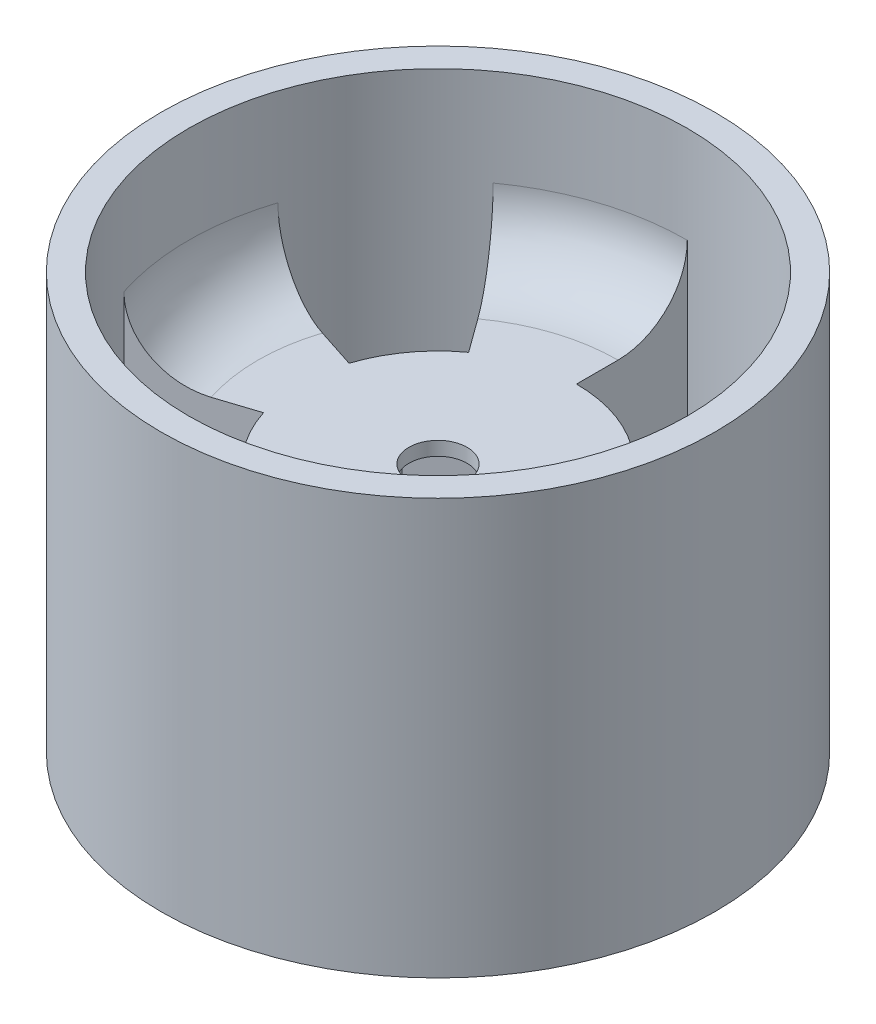
from build123d import *
from build123d.topology import SkipClean

# Parameters (mm, degrees)
SKETCH1_R           = 18
BOSS_EXTRUDE1_DEPTH = 6
CUT_EXTRUDE1_DEPTH  = 5
SKETCH1_28_R        = 2.1
CUT_EXTRUDE2_DEPTH  = 27.153393661
SKETCH1_29_R        = 20
SKETCH1_29_R_2      = 18
BOSS_EXTRUDE2_DEPTH = 18
CUT_EXTRUDE3_DEPTH  = 10
BOSS_EXTRUDE3_START = -12
SKETCH1_30_R        = 20
SKETCH1_30_R_2      = 18
BOSS_EXTRUDE3_DEPTH = 12
FILLET1_ANGLE       = 36
FILLET1_2_ANGLE     = 36
FILLET1_3_ANGLE     = 36
FILLET1_4_ANGLE     = 36
FILLET1_5_ANGLE     = 36


with BuildPart() as part:
    # Sketch1 → Boss-Extrude1 (new body)
    with BuildSketch(Plane(origin=(0, 0, 0), x_dir=(1, 0, 0), z_dir=(0, 1, 0))):
        with Locations(Location((0, 0, 0), (0, 0, 270))):
            Circle(SKETCH1_R)
    extrude(amount=BOSS_EXTRUDE1_DEPTH)

    # Sketch1<27> → Cut-Extrude1 (cut)
    with BuildSketch(Plane(origin=(0, 0, 0), x_dir=(1, 0, 0), z_dir=(0, 1, 0))):
        Polygon((0, -7.101408311), (6.15, -3.550704156), (6.15, 3.550704156), (0, 7.101408311), (-6.15, 3.550704156), (-6.15, -3.550704156), align=None)
    extrude(amount=CUT_EXTRUDE1_DEPTH, mode=Mode.SUBTRACT)

    # Sketch1<28> → Cut-Extrude2 (cut, through all)
    with BuildSketch(Plane(origin=(0, 0, 0), x_dir=(1, 0, 0), z_dir=(0, 1, 0))):
        with Locations(Location((0, 0, 0), (0, 0, 270))):
            Circle(SKETCH1_28_R)
    extrude(amount=CUT_EXTRUDE2_DEPTH, mode=Mode.SUBTRACT)

    # Sketch1<29> → Boss-Extrude2 (add)
    with BuildSketch(Plane(origin=(0, 0, 0), x_dir=(1, 0, 0), z_dir=(0, 1, 0))):
        with Locations(Location((0, 0, 0), (0, 0, 270))):
            Circle(SKETCH1_29_R)
        with Locations(Location((0, 0, 0), (0, 0, 270))):
            Circle(SKETCH1_29_R_2, mode=Mode.SUBTRACT)
    extrude(amount=BOSS_EXTRUDE2_DEPTH)

    # Sketch2 → Cut-Extrude3 (cut)
    with SkipClean():  # the faces are left unmerged after this step: merging them gives an invalid solid
        with BuildSketch(Plane.XZ):
            with BuildLine():
                ThreePointArc((5.877852523, -8.090169944), (3.090169944, -9.510565163), (0, -10))
                Line((0, -10), (0, -18))
                ThreePointArc((0, -18), (5.562305899, -17.119017293), (10.580134541, -14.562305899))
                Line((10.580134541, -14.562305899), (5.877852523, -8.090169944))
            make_face()
            with BuildLine():
                Line((-10.580134541, -14.562305899), (-5.877852523, -8.090169944))
                ThreePointArc((-5.877852523, -8.090169944), (-8.090169944, -5.877852523), (-9.510565163, -3.090169944))
                Line((-9.510565163, -3.090169944), (-17.119017293, -5.562305899))
                ThreePointArc((-17.119017293, -5.562305899), (-14.562305899, -10.580134541), (-10.580134541, -14.562305899))
            make_face()
            with BuildLine():
                Line((-17.119017293, 5.562305899), (-9.510565163, 3.090169944))
                ThreePointArc((-9.510565163, 3.090169944), (-8.090169944, 5.877852523), (-5.877852523, 8.090169944))
                Line((-5.877852523, 8.090169944), (-10.580134541, 14.562305899))
                ThreePointArc((-10.580134541, 14.562305899), (-14.562305899, 10.580134541), (-17.119017293, 5.562305899))
            make_face()
            with BuildLine():
                Line((0, 18), (0, 10))
                ThreePointArc((0, 10), (3.090169944, 9.510565163), (5.877852523, 8.090169944))
                Line((5.877852523, 8.090169944), (10.580134541, 14.562305899))
                ThreePointArc((10.580134541, 14.562305899), (5.562305899, 17.119017293), (0, 18))
            make_face()
            with BuildLine():
                ThreePointArc((10, 0), (9.876883406, -1.56434465), (9.510565163, -3.090169944))
                Line((9.510565163, -3.090169944), (17.119017293, -5.562305899))
                ThreePointArc((17.119017293, -5.562305899), (17.778390131, -2.815820371), (18, 0))
                ThreePointArc((18, 0), (17.778390131, 2.815820371), (17.119017293, 5.562305899))
                Line((17.119017293, 5.562305899), (9.510565163, 3.090169944))
                ThreePointArc((9.510565163, 3.090169944), (9.876883406, 1.56434465), (10, 0))
            make_face()
        extrude(amount=-CUT_EXTRUDE3_DEPTH, mode=Mode.SUBTRACT)
    add(part.part.scale(1), mode=Mode.REPLACE)  # the faces are merged on a copy

    # Sketch1<30> → Boss-Extrude3 (add)
    with SkipClean():  # the faces are left unmerged after this step: merging them gives an invalid solid
        with BuildSketch(Plane(origin=(0, 0, 0), x_dir=(1, 0, 0), z_dir=(0, 1, 0)).offset(BOSS_EXTRUDE3_START)):
            with Locations(Location((0, 0, 0), (0, 0, 270))):
                Circle(SKETCH1_30_R)
            with Locations(Location((0, 0, 0), (0, 0, 270))):
                Circle(SKETCH1_30_R_2, mode=Mode.SUBTRACT)
        extrude(amount=BOSS_EXTRUDE3_DEPTH)

    # Fillet1: read off the stored shape, not the designer's step
    # Fillet1 outline → Fillet1 (revolve)
    with SkipClean():  # the faces are left unmerged after this step: merging them gives an invalid solid
        with BuildSketch(Plane(origin=(0, 0, 0), x_dir=(-0.9510565162951906, 0, -0.3090169943748335), z_dir=(0.3090169943748335, 0, -0.9510565162951906))):
            with BuildLine():
                ThreePointArc((18, 11), (16.535533906, 7.464466094), (13, 6))
                Line((13, 6), (18, 6))
                Line((18, 6), (18, 11))
            make_face()
            with BuildLine():
                Line((18, 0), (13, 0))
                ThreePointArc((13, 0), (16.535533906, -1.464466094), (18, -5))
                Line((18, -5), (18, 0))
            make_face()
        revolve(axis=Axis((0, 0, 0), (0, 1, 0)), revolution_arc=FILLET1_ANGLE)

    # Fillet1 2 outline → Fillet1 2 (revolve)
    with SkipClean():  # the faces are left unmerged after this step: merging them gives an invalid solid
        with BuildSketch(Plane(origin=(0, 0, 0), x_dir=(-0.5877852522922776, 0, 0.8090169943750894), z_dir=(-0.8090169943750894, 0, -0.5877852522922776))):
            with BuildLine():
                ThreePointArc((18, 11), (16.535533906, 7.464466094), (13, 6))
                Line((13, 6), (18, 6))
                Line((18, 6), (18, 11))
            make_face()
            with BuildLine():
                Line((18, 0), (13, 0))
                ThreePointArc((13, 0), (16.535533906, -1.464466094), (18, -5))
                Line((18, -5), (18, 0))
            make_face()
        revolve(axis=Axis((0, 0, 0), (0, 1, 0)), revolution_arc=FILLET1_2_ANGLE)

    # Fillet1 3 outline → Fillet1 3 (revolve)
    with SkipClean():  # the faces are left unmerged after this step: merging them gives an invalid solid
        with BuildSketch(Plane(origin=(0, 0, 0), x_dir=(0.5877852522925205, 0, 0.809016994374913), z_dir=(-0.809016994374913, 0, 0.5877852522925205))):
            with BuildLine():
                ThreePointArc((18, 11), (16.535533906, 7.464466094), (13, 6))
                Line((13, 6), (18, 6))
                Line((18, 6), (18, 11))
            make_face()
            with BuildLine():
                Line((18, 0), (13, 0))
                ThreePointArc((13, 0), (16.535533906, -1.464466094), (18, -5))
                Line((18, -5), (18, 0))
            make_face()
        revolve(axis=Axis((0, 0, 0), (0, 1, 0)), revolution_arc=FILLET1_3_ANGLE)

    # Fillet1 4 outline → Fillet1 4 (revolve)
    with SkipClean():  # the faces are left unmerged after this step: merging them gives an invalid solid
        with BuildSketch(Plane(origin=(0, 0, 0), x_dir=(0, 0, -1), z_dir=(1, 0, 0))):
            with BuildLine():
                ThreePointArc((18, 11), (16.535533906, 7.464466094), (13, 6))
                Line((13, 6), (18, 6))
                Line((18, 6), (18, 11))
            make_face()
            with BuildLine():
                Line((18, 0), (13, 0))
                ThreePointArc((13, 0), (16.535533906, -1.464466094), (18, -5))
                Line((18, -5), (18, 0))
            make_face()
        revolve(axis=Axis((0, 0, 0), (0, 1, 0)), revolution_arc=FILLET1_4_ANGLE)

    # Fillet1 5 outline → Fillet1 5 (revolve)
    with SkipClean():  # the faces are left unmerged after this step: merging them gives an invalid solid
        with BuildSketch(Plane(origin=(0, 0, 0), x_dir=(0.9510565162951443, 0, -0.3090169943749758), z_dir=(0.3090169943749758, 0, 0.9510565162951443))):
            with BuildLine():
                ThreePointArc((18, 11), (16.535533906, 7.464466094), (13, 6))
                Line((13, 6), (18, 6))
                Line((18, 6), (18, 11))
            make_face()
            with BuildLine():
                Line((18, 0), (13, 0))
                ThreePointArc((13, 0), (16.535533906, -1.464466094), (18, -5))
                Line((18, -5), (18, 0))
            make_face()
        revolve(axis=Axis((0, 0, 0), (0, 1, 0)), revolution_arc=FILLET1_5_ANGLE)


solid = part.part
